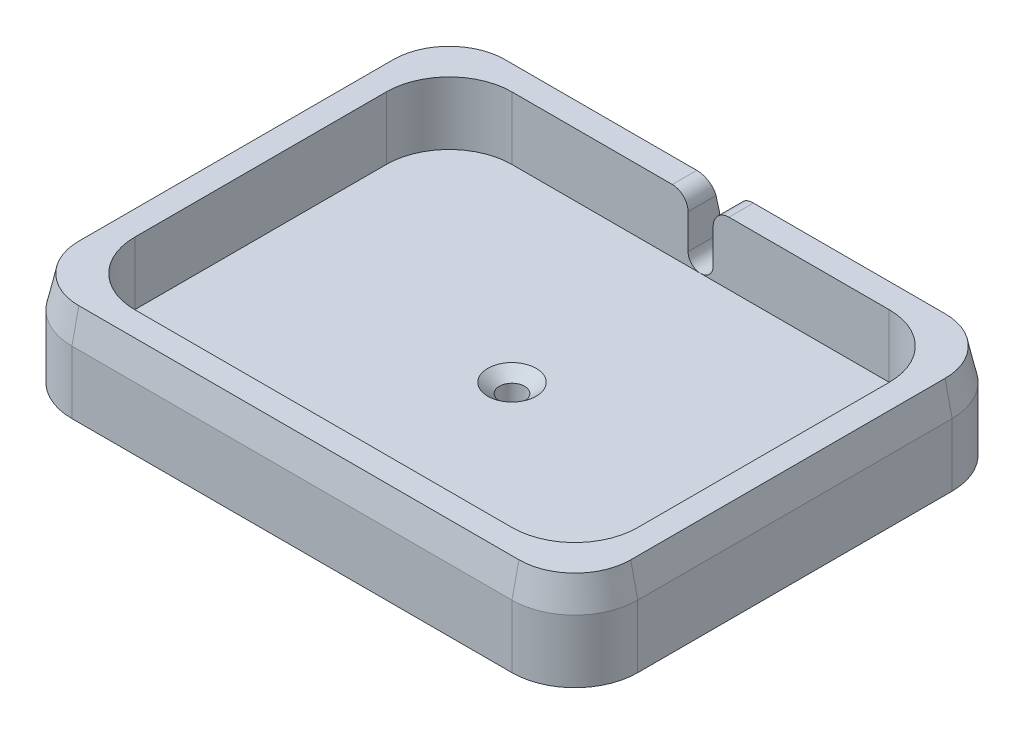
from build123d import *

# Parameters (mm, degrees)
SKETCH1_W                                          = 114.3
SKETCH1_H                                          = 88.9
SKETCH1_W_2                                        = 101.6
SKETCH1_H_2                                        = 76.2
BOSS_EXTRUDE1_DEPTH                                = 12.7
SKETCH2_W                                          = 114.3
SKETCH2_H                                          = 88.9
BOSS_EXTRUDE2_DEPTH                                = 6.35
FILLET1_R                                          = 12.7
CUT_EXTRUDE1_REACH                                 = 108.445
FILLET2_R                                          = 3.175
CSK_FOR_10_FLAT_HEAD_MACHINE_SCREW_100_D           = 5.1054
CSK_FOR_10_FLAT_HEAD_MACHINE_SCREW_100_CSINK_D     = 9.779
CSK_FOR_10_FLAT_HEAD_MACHINE_SCREW_100_CSINK_ANGLE = 100
CHAMFER1_SIZE                                      = 1.407761108
CHAMFER1_SIZE_2                                    = 6.35


with BuildPart() as part:
    # Sketch1 → Boss-Extrude1 (new body)
    with BuildSketch(Plane(origin=(0, 0, 0), x_dir=(1, 0, 0), z_dir=(0, 1, 0))):
        Rectangle(SKETCH1_W, SKETCH1_H)
        Rectangle(SKETCH1_W_2, SKETCH1_H_2, mode=Mode.SUBTRACT)
    extrude(amount=BOSS_EXTRUDE1_DEPTH)

    # Sketch2 → Boss-Extrude2 (add)
    with BuildSketch(Plane.XZ):
        Rectangle(SKETCH2_W, SKETCH2_H)
    extrude(amount=BOSS_EXTRUDE2_DEPTH)

    # Fillet1
    fillet1_edges = [part.edges().sort_by_distance(p)[0] for p in [
        (50.8, 6.35, 38.1),
        (50.8, 6.35, -38.1),
        (-50.8, 6.35, -38.1),
        (-50.8, 6.35, 38.1),
        (-57.15, 3.175, 44.45),
        (-57.15, 3.175, -44.45),
        (57.15, 3.175, -44.45),
        (57.15, 3.175, 44.45),
    ]]
    fillet(fillet1_edges, radius=FILLET1_R)

    # Sketch3 → Cut-Extrude1 (cut, up to next)
    with BuildSketch(Plane(origin=(0, 0, -44.45), x_dir=(-1, 0, 0), z_dir=(0, 0, -1)), mode=Mode.PRIVATE) as cut_extrude1_sk1:
        with BuildLine():
            Line((2.54, 22.86), (2.54, 2.54))
            ThreePointArc((2.54, 2.54), (0, 0), (-2.54, 2.54))
            Line((-2.54, 2.54), (-2.54, 22.86))
            ThreePointArc((-2.54, 22.86), (0, 25.4), (2.54, 22.86))
        make_face()
    cut_extrude1_tool1 = extrude(cut_extrude1_sk1.sketch, amount=-CUT_EXTRUDE1_REACH, mode=Mode.PRIVATE) & part.part
    add(cut_extrude1_tool1.solids().sort_by_distance((0, 12.7, -44.45))[0], mode=Mode.SUBTRACT)

    # Fillet2
    fillet2_edges = [part.edges().sort_by_distance(p)[0] for p in [
        (2.54, 12.7, -41.275),
        (-2.54, 12.7, -41.275),
    ]]
    fillet(fillet2_edges, radius=FILLET2_R)

    # CSK for #10 Flat Head Machine Screw (100)1 (through all)
    with Locations(Plane(origin=(0, 0, 0), x_dir=(1, 0, 0), z_dir=(0, 1, 0))):
        with Locations((0, 0)):
            CounterSinkHole(CSK_FOR_10_FLAT_HEAD_MACHINE_SCREW_100_D / 2, CSK_FOR_10_FLAT_HEAD_MACHINE_SCREW_100_CSINK_D / 2, counter_sink_angle=CSK_FOR_10_FLAT_HEAD_MACHINE_SCREW_100_CSINK_ANGLE)

    # Chamfer1
    # the kernel refuses this chamfer: 6.35, 1.407761108 mm, written as the material it takes off along each edge
    with BuildSketch(Plane(origin=(-44.45, 12.7, -44.45), x_dir=(0, 0.16714603522124954, 0.9859321492424399), z_dir=(1, 0, 0)), Plane(origin=(-10.78052054, 12.7, -44.45), x_dir=(0, 0.16714603522124954, 0.9859321492424399), z_dir=(1, 0, 0))) as chamfer1_piece_1:
        Polygon((CHAMFER1_SIZE * 0.98593214909, CHAMFER1_SIZE * 0.167146035195), (-CHAMFER1_SIZE_2 * 0.167146035221, CHAMFER1_SIZE_2 * 0.985932149242), (0, 0), align=None)
    extrude(amount=55.23052054, mode=Mode.SUBTRACT)
    with BuildSketch(Plane(origin=(57.15, 12.7, -31.75), x_dir=(-0.9859321492424399, 0.16714603522124954, 0), z_dir=(0, 0, 1)), Plane(origin=(-57.15, 12.7, 31.75), x_dir=(0.9859321492424399, 0.16714603522124954, 0), z_dir=(0, 0, -1))) as chamfer1_piece_2:
        Polygon((CHAMFER1_SIZE * 0.98593214909, CHAMFER1_SIZE * 0.167146035195), (-CHAMFER1_SIZE_2 * 0.167146035221, CHAMFER1_SIZE_2 * 0.985932149242), (0, 0), align=None)
    extrude(amount=63.5, mode=Mode.SUBTRACT)
    with BuildSketch(Plane(origin=(44.45, 12.7, 44.45), x_dir=(0, 0.16714603522124954, -0.9859321492424399), z_dir=(-1, 0, 0))) as chamfer1_piece_3:
        Polygon((CHAMFER1_SIZE * 0.98593214909, CHAMFER1_SIZE * 0.167146035195), (-CHAMFER1_SIZE_2 * 0.167146035221, CHAMFER1_SIZE_2 * 0.985932149242), (0, 0), align=None)
    extrude(amount=88.9, mode=Mode.SUBTRACT)
    with BuildSketch(Plane(origin=(44.45, 12.7, -31.75), x_dir=(1, 0, 0), z_dir=(0, 0, 1))) as chamfer1_piece_4:
        Polygon((12.7 - CHAMFER1_SIZE, 0), (12.7, -CHAMFER1_SIZE_2), (12.7, 0), align=None)
    revolve(axis=Axis((44.45, 12.7, -31.75), (0, 1, 0)), revolution_arc=90, mode=Mode.SUBTRACT)
    with BuildSketch(Plane(origin=(-44.45, 12.7, -31.75), x_dir=(-1, 0, 0), z_dir=(0, 0, 1))) as chamfer1_piece_5:
        Polygon((12.7 - CHAMFER1_SIZE, 0), (12.7, CHAMFER1_SIZE_2), (12.7, 0), align=None)
    revolve(axis=Axis((-44.45, 12.7, -31.75), (0, -1, 0)), revolution_arc=90, mode=Mode.SUBTRACT)
    with BuildSketch(Plane(origin=(-44.45, 12.7, 31.75), x_dir=(-1, 0, 0), z_dir=(0, 0, -1))) as chamfer1_piece_6:
        Polygon((12.7 - CHAMFER1_SIZE, 0), (12.7, -CHAMFER1_SIZE_2), (12.7, 0), align=None)
    revolve(axis=Axis((-44.45, 12.7, 31.75), (0, 1, 0)), revolution_arc=90, mode=Mode.SUBTRACT)
    with BuildSketch(Plane(origin=(44.45, 12.7, 31.75), x_dir=(0, 0, 1), z_dir=(-1, 0, 0))) as chamfer1_piece_7:
        Polygon((12.7 - CHAMFER1_SIZE, 0), (12.7, -CHAMFER1_SIZE_2), (12.7, 0), align=None)
    revolve(axis=Axis((44.45, 12.7, 31.75), (0, 1, 0)), revolution_arc=90, mode=Mode.SUBTRACT)


solid = part.part
